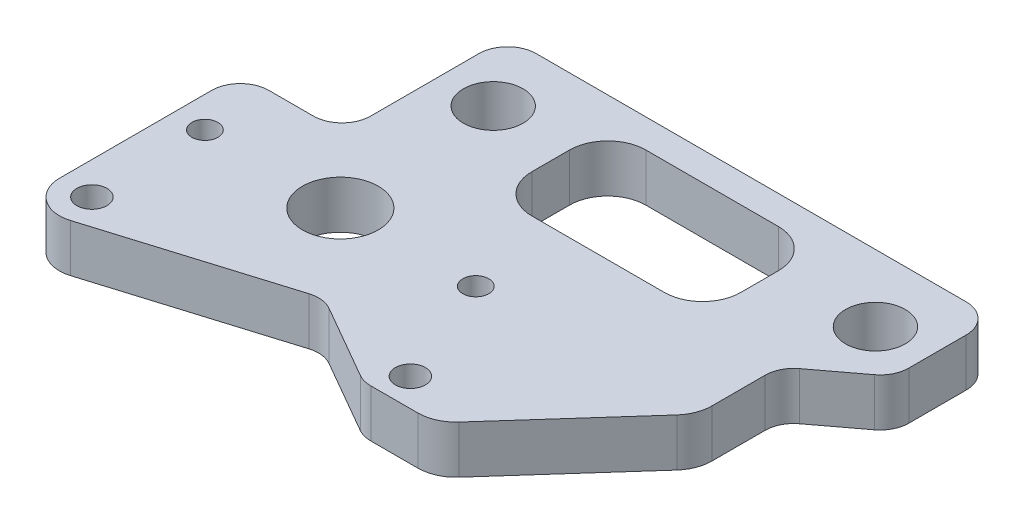
from build123d import *

# Parameters (mm, degrees)
SKETCH4_R           = 2
SKETCH4_R_2         = 1.7272
SKETCH4_R_3         = 5.04
SKETCH4_R_4         = 3.96875
BOSS_EXTRUDE2_DEPTH = 6.35


with BuildPart() as part:
    # Sketch4 → Boss-Extrude2 (new body)
    with BuildSketch(Plane(origin=(0, 0, 0), x_dir=(1, 0, 0), z_dir=(0, 1, 0))):
        with BuildLine():
            Line((22.483900583, -18.4375), (28.735494078, -18.4375))
            ThreePointArc((28.735494078, -18.4375), (30.811694527, -17.993855432), (32.52525913, -16.740410116))
            Line((32.52525913, -16.740410116), (46.178246767, -1.445408582))
            ThreePointArc((46.178246767, -1.445408582), (47.134975498, 0.127198584), (47.468481715, 1.937501533))
            Line((47.468481715, 1.937501533), (47.468481715, 8.985116992))
            ThreePointArc((47.468481715, 8.985116992), (47.868781798, 10.685130659), (48.985566477, 12.027918285))
            Line((48.985566477, 12.027918285), (54.680415238, 16.319294633))
            ThreePointArc((54.680415238, 16.319294633), (55.797199918, 17.662082259), (56.1975, 19.362095927))
            Line((56.1975, 19.362095927), (56.1975, 26.9875))
            ThreePointArc((56.1975, 26.9875), (55.081576836, 29.681576836), (52.3875, 30.7975))
            Line((52.3875, 30.7975), (-4.7625, 30.7975))
            ThreePointArc((-4.7625, 30.7975), (-7.456576836, 29.681576836), (-8.5725, 26.9875))
            Line((-8.5725, 26.9875), (-8.5725, 12.607500122))
            ThreePointArc((-8.5725, 12.607500122), (-9.688423164, 9.913423286), (-12.3825, 8.797500122))
            Line((-12.3825, 8.797500122), (-18.288, 8.797500122))
            ThreePointArc((-18.288, 8.797500122), (-20.982076836, 7.681576958), (-22.098, 4.987500122))
            Line((-22.098, 4.987500122), (-22.098, -15.24))
            ThreePointArc((-22.098, -15.24), (-20.348558836, -18.710969534), (-16.517810325, -19.369406885))
            Line((-16.517810325, -19.369406885), (7.765559219, -11.946980575))
            ThreePointArc((7.765559219, -11.946980575), (9.307944036, -11.804768953), (10.779476649, -12.288263354))
            Line((10.779476649, -12.288263354), (20.583679925, -17.929811531))
            ThreePointArc((20.583679925, -17.929811531), (21.500464498, -18.308390309), (22.483900583, -18.4375))
        make_face()
        with Locations((-17.78, -15.24)):
            Circle(SKETCH4_R, mode=Mode.SUBTRACT)
        with Locations((-18.000000004, 0)):
            Circle(SKETCH4_R_2, mode=Mode.SUBTRACT)
        Circle(SKETCH4_R_3, mode=Mode.SUBTRACT)
        with Locations((24.012521227, -14.703599027)):
            Circle(SKETCH4_R, mode=Mode.SUBTRACT)
        with Locations((18.000000004, 0)):
            Circle(SKETCH4_R_2, mode=Mode.SUBTRACT)
        with Locations((-1.5875, 21.9075)):
            Circle(SKETCH4_R_4, mode=Mode.SUBTRACT)
        with BuildLine():
            ThreePointArc((8.544719667, 21.9075), (10.032617219, 25.499602448), (13.624719667, 26.9875))
            Line((13.624719667, 26.9875), (31.244858643, 26.9875))
            ThreePointArc((31.244858643, 26.9875), (34.836961091, 25.499602448), (36.324858643, 21.9075))
            Line((36.324858643, 21.9075), (36.324858643, 16.899253972))
            ThreePointArc((36.324858643, 16.899253972), (34.836961091, 13.307151523), (31.244858643, 11.819253972))
            Line((31.244858643, 11.819253972), (13.624719667, 11.819253972))
            ThreePointArc((13.624719667, 11.819253972), (10.032617219, 13.307151523), (8.544719667, 16.899253972))
            Line((8.544719667, 16.899253972), (8.544719667, 21.9075))
        make_face(mode=Mode.SUBTRACT)
        with Locations((49.2125, 21.9075)):
            Circle(SKETCH4_R_4, mode=Mode.SUBTRACT)
    extrude(amount=-BOSS_EXTRUDE2_DEPTH)


solid = part.part
